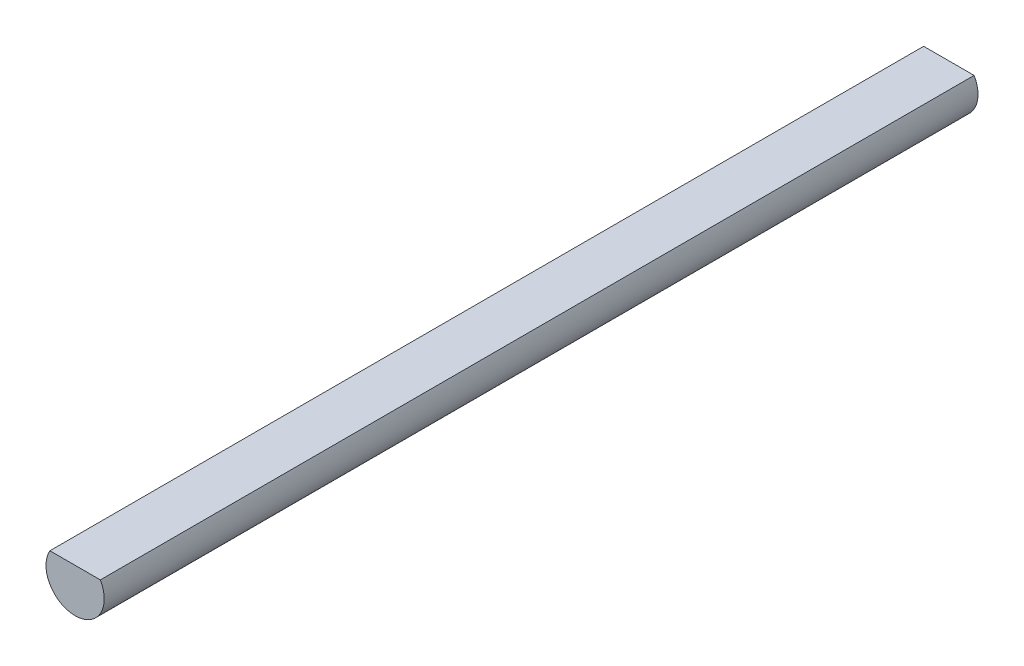
from build123d import *

# Parameters (mm, degrees)
SKETCH1_R           = 1.999996
BOSS_EXTRUDE1_DEPTH = 60
CUT_EXTRUDE1_DEPTH  = 61.066629404


with BuildPart() as part:
    # Sketch1 → Boss-Extrude1 (new body)
    with BuildSketch(Plane.XY):
        Circle(SKETCH1_R)
    extrude(amount=BOSS_EXTRUDE1_DEPTH)

    # Sketch3 → Cut-Extrude1 (cut, through all)
    with BuildSketch(Plane.XY.offset(60)):
        with BuildLine():
            Line((-1.732050808, 1), (1.732050808, 1))
            ThreePointArc((1.732050808, 1), (0, 2), (-1.732050808, 1))
        make_face()
    extrude(amount=-CUT_EXTRUDE1_DEPTH, mode=Mode.SUBTRACT)


solid = part.part
